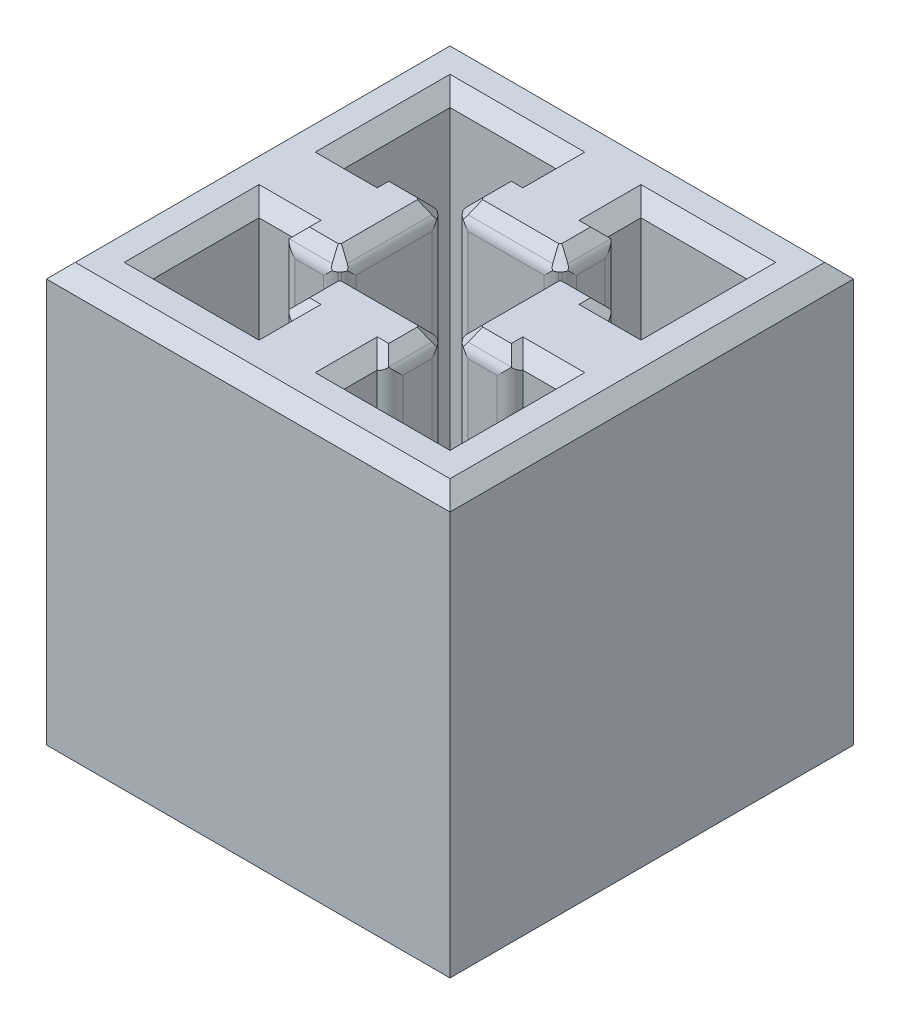
from build123d import *

# Parameters (mm, degrees)
SKETCH_2_W      = 28
SKETCH_2_H      = 28
SKETCH_2_W_2    = 20.6
SKETCH_2_H_2    = 20.6
EXTRUDE_2_DEPTH = 30
CHAMFER_1_SIZE  = 1
FILLET_3_R      = 1


with BuildPart() as part:
    # 草图2 → 凸台-拉伸2 (new body)
    # profile 1 of 5: a face of its own
    with BuildSketch(Plane(origin=(0, 0, 0), x_dir=(1, 0, 0), z_dir=(0, 1, 0))):
        Rectangle(SKETCH_2_W, SKETCH_2_H)
        Rectangle(SKETCH_2_W_2, SKETCH_2_H_2, mode=Mode.SUBTRACT)
    # profile 2 of 5: a face of its own
    with BuildSketch(Plane(origin=(0, 0, 0), x_dir=(1, 0, 0), z_dir=(0, 1, 0))):
        Polygon((-2.95, -8), (-2.95, -10.3), (2.95, -10.3), (2.95, -8), (3.75, -8), (3.75, -4.598528137), (3.051471863, -3.9), (-3.051471863, -3.9), (-3.75, -4.598528137), (-3.75, -8), align=None)
    # profile 3 of 5: a face of its own
    with BuildSketch(Plane(origin=(0, 0, 0), x_dir=(1, 0, 0), z_dir=(0, 1, 0))):
        Polygon((10.3, -2.95), (10.3, 2.95), (8, 2.95), (8, 3.75), (4.598528137, 3.75), (3.9, 3.051471863), (3.9, -3.051471863), (4.598528137, -3.75), (8, -3.75), (8, -2.95), align=None)
    # profile 4 of 5: a face of its own
    with BuildSketch(Plane(origin=(0, 0, 0), x_dir=(1, 0, 0), z_dir=(0, 1, 0))):
        Polygon((2.95, 10.3), (-2.95, 10.3), (-2.95, 8), (-3.75, 8), (-3.75, 4.598528137), (-3.051471863, 3.9), (3.051471863, 3.9), (3.75, 4.598528137), (3.75, 8), (2.95, 8), align=None)
    # profile 5 of 5: a face of its own
    with BuildSketch(Plane(origin=(0, 0, 0), x_dir=(1, 0, 0), z_dir=(0, 1, 0))):
        Polygon((-8, 2.95), (-10.3, 2.95), (-10.3, -2.95), (-8, -2.95), (-8, -3.75), (-4.598528137, -3.75), (-3.9, -3.051471863), (-3.9, 3.051471863), (-4.598528137, 3.75), (-8, 3.75), align=None)
    extrude(amount=EXTRUDE_2_DEPTH)

    # 倒角1
    chamfer_1_edges = [part.edges().sort_by_distance(p)[0] for p in [
        (6.299264069, 30, -3.75),
        (4.249264069, 30, -3.400735931),
        (3.9, 30, 0),
        (4.249264069, 30, 3.400735931),
        (-10.3, 30, -6.625),
        (6.299264069, 30, 3.75),
        (8, 30, 3.35),
        (9.15, 30, 2.95),
        (10.3, 30, 6.625),
        (6.625, 30, 10.3),
        (2.95, 30, 9.15),
        (3.35, 30, 8),
        (3.75, 30, 6.299264069),
        (3.400735931, 30, 4.249264069),
        (0, 30, 3.9),
        (-6.625, 30, -10.3),
        (-3.400735931, 30, 4.249264069),
        (-3.75, 30, 6.299264069),
        (-3.35, 30, 8),
        (-2.95, 30, 9.15),
        (-6.625, 30, 10.3),
        (-10.3, 30, 6.625),
        (-9.15, 30, 2.95),
        (-8, 30, 3.35),
        (-6.299264069, 30, 3.75),
        (-4.249264069, 30, 3.400735931),
        (-3.9, 30, 0),
        (-2.95, 30, -9.15),
        (-4.249264069, 30, -3.400735931),
        (-6.299264069, 30, -3.75),
        (-8, 30, -3.35),
        (-14, 30, 0),
        (0, 30, 14),
        (14, 30, 0),
        (0, 30, -14),
        (-3.35, 30, -8),
        (-3.75, 30, -6.299264069),
        (-3.400735931, 30, -4.249264069),
        (0, 30, -3.9),
        (3.400735931, 30, -4.249264069),
        (0, 0, -14),
        (14, 0, 0),
        (0, 0, 14),
        (-14, 0, 0),
        (-8, 0, -3.35),
        (-6.299264069, 0, -3.75),
        (-4.249264069, 0, -3.400735931),
        (-3.9, 0, 0),
        (-4.249264069, 0, 3.400735931),
        (-6.299264069, 0, 3.75),
        (-9.15, 30, -2.95),
        (3.75, 30, -6.299264069),
        (-8, 0, 3.35),
        (-9.15, 0, 2.95),
        (-10.3, 0, 6.625),
        (-6.625, 0, 10.3),
        (-2.95, 0, 9.15),
        (-3.35, 0, 8),
        (-3.75, 0, 6.299264069),
        (-3.400735931, 0, 4.249264069),
        (0, 0, 3.9),
        (3.400735931, 0, 4.249264069),
        (3.35, 30, -8),
        (3.75, 0, 6.299264069),
        (3.35, 0, 8),
        (2.95, 0, 9.15),
        (6.625, 0, 10.3),
        (10.3, 0, 6.625),
        (9.15, 0, 2.95),
        (8, 0, 3.35),
        (6.299264069, 0, 3.75),
        (4.249264069, 0, 3.400735931),
        (3.9, 0, 0),
        (2.95, 30, -9.15),
        (4.249264069, 0, -3.400735931),
        (6.299264069, 0, -3.75),
        (8, 0, -3.35),
        (9.15, 0, -2.95),
        (10.3, 0, -6.625),
        (6.625, 0, -10.3),
        (2.95, 0, -9.15),
        (3.35, 0, -8),
        (3.75, 0, -6.299264069),
        (3.400735931, 0, -4.249264069),
        (6.625, 30, -10.3),
        (0, 0, -3.9),
        (-3.400735931, 0, -4.249264069),
        (-3.75, 0, -6.299264069),
        (-3.35, 0, -8),
        (-2.95, 0, -9.15),
        (-6.625, 0, -10.3),
        (-10.3, 0, -6.625),
        (10.3, 30, -6.625),
        (-9.15, 0, -2.95),
        (9.15, 30, -2.95),
        (8, 30, -3.35),
    ]]
    chamfer(chamfer_1_edges, length=CHAMFER_1_SIZE)

    # 圆角3
    # the kernel refuses this fillet: 1 mm, written as the material it takes off along each edge
    with BuildSketch(Plane(origin=(3.75, 1, 9.035533906), x_dir=(-0.7071067811865477, -0.7071067811865474, 0), z_dir=(0, 0, -1)), Plane(origin=(9.035533906, 1, -3.75), x_dir=(0, -0.7071067811865477, 0.7071067811865474), z_dir=(-1, 0, 0)), Plane(origin=(3.562994231, 1, 3.75), x_dir=(0, -0.7071067811865475, -0.7071067811865477), z_dir=(1, 0, 0)), Plane(origin=(-3.75, 1, 3.562994231), x_dir=(0.7071067811865472, -0.7071067811865478, 0), z_dir=(0, 0, 1)), Plane(origin=(3.75, 1, -3.562994231), x_dir=(-0.7071067811865477, -0.7071067811865475, 0), z_dir=(0, 0, -1)), Plane(origin=(-3.75, 1, -9.035533906), x_dir=(0.7071067811865472, -0.7071067811865478, 0), z_dir=(0, 0, 1)), Plane(origin=(-3.562994231, 1, -3.75), x_dir=(0, -0.7071067811865475, 0.7071067811865477), z_dir=(-1, 0, 0)), Plane(origin=(-9.035533906, 1, 3.75), x_dir=(0, -0.7071067811865475, -0.7071067811865477), z_dir=(1, 0, 0))) as fillet_3_piece_1:
        with BuildLine():
            CenterArc((FILLET_3_R * 0.414213562373, FILLET_3_R), FILLET_3_R, 225, 45)
            Line((-FILLET_3_R * 0.292893218813, FILLET_3_R * 0.292893218813), (-FILLET_3_R * 0.307035354437, FILLET_3_R * 0.27875108319))
            Line((-FILLET_3_R * 0.307035354437, FILLET_3_R * 0.27875108319), (-FILLET_3_R * 0.00828427124746, -FILLET_3_R * 0.02))
            Line((-FILLET_3_R * 0.00828427124746, -FILLET_3_R * 0.02), (FILLET_3_R * 0.414213562373, -FILLET_3_R * 0.02))
            Line((FILLET_3_R * 0.414213562373, -FILLET_3_R * 0.02), (FILLET_3_R * 0.414213562373, 0))
        make_face()
    extrude(amount=5.472539674, mode=Mode.SUBTRACT)
    with BuildSketch(Plane(origin=(3.75, -1.449489743, 8), x_dir=(0, 0, -1), z_dir=(0, 1, 0)), Plane(origin=(-8, -1.449489743, 3.75), x_dir=(1, 0, 0), z_dir=(0, 1, 0))) as fillet_3_piece_2:
        with BuildLine():
            CenterArc((0.979795897, 1), FILLET_3_R, 191.536959033, 78.463040967)
            Line((0, 0.8), (-0.019595918, 0.796))
            ThreePointArc((-0.019595918, 0.796), (-0.02, 0.4), (-0.02, 0))
            Line((-0.02, 0), (0, -0.02))
            Line((0, -0.02), (0.979795897, -0.02))
            Line((0.979795897, -0.02), (0.979795897, 0))
        make_face()
    extrude(amount=32.898979486, mode=Mode.SUBTRACT)
    with BuildSketch(Plane(origin=(3.75, 29, 9.035533906), x_dir=(-0.7071067811865487, 0.7071067811865465, 0), z_dir=(0, 0, -1)), Plane(origin=(9.035533906, 29, -3.75), x_dir=(0, 0.7071067811865476, 0.7071067811865476), z_dir=(-1, 0, 0)), Plane(origin=(3.562994231, 29, 3.75), x_dir=(0, 0.707106781186547, -0.707106781186548), z_dir=(1, 0, 0)), Plane(origin=(-3.75, 29, 3.562994231), x_dir=(0.7071067811865459, 0.7071067811865491, 0), z_dir=(0, 0, 1)), Plane(origin=(3.75, 29, -3.562994231), x_dir=(-0.707106781186548, 0.707106781186547, 0), z_dir=(0, 0, -1)), Plane(origin=(-3.75, 29, -9.035533906), x_dir=(0.7071067811865465, 0.7071067811865487, 0), z_dir=(0, 0, 1)), Plane(origin=(-3.562994231, 29, -3.75), x_dir=(0, 0.707106781186547, 0.707106781186548), z_dir=(-1, 0, 0)), Plane(origin=(-9.035533906, 29, 3.75), x_dir=(0, 0.707106781186547, -0.707106781186548), z_dir=(1, 0, 0))) as fillet_3_piece_3:
        with BuildLine():
            CenterArc((FILLET_3_R * 0.414213562373, -FILLET_3_R), FILLET_3_R, 90, 45)
            Line((-FILLET_3_R * 0.292893218813, -FILLET_3_R * 0.292893218813), (-FILLET_3_R * 0.307035354437, -FILLET_3_R * 0.27875108319))
            Line((-FILLET_3_R * 0.307035354437, -FILLET_3_R * 0.27875108319), (-FILLET_3_R * 0.00828427124746, FILLET_3_R * 0.02))
            Line((-FILLET_3_R * 0.00828427124746, FILLET_3_R * 0.02), (FILLET_3_R * 0.414213562373, FILLET_3_R * 0.02))
            Line((FILLET_3_R * 0.414213562373, FILLET_3_R * 0.02), (FILLET_3_R * 0.414213562373, 0))
        make_face()
    extrude(amount=5.472539674, mode=Mode.SUBTRACT)
    with BuildSketch(Plane(origin=(3.75, -0.035533906, 4.598528137), x_dir=(-0.7071067811865872, 0, -0.7071067811865078), z_dir=(0, 1, 0)), Plane(origin=(3.051471863, -0.035533906, 3.9), x_dir=(-1, 0, 0), z_dir=(0, 1, 0)), Plane(origin=(-3.051471863, -0.035533906, 3.9), x_dir=(-0.7071067811865154, 0, 0.7071067811865797), z_dir=(0, 1, 0)), Plane(origin=(-3.75, -0.035533906, 4.598528137), x_dir=(0, 0, 1), z_dir=(0, 1, 0)), Plane(origin=(-4.598528137, -0.035533906, -3.75), x_dir=(-1, 0, 0), z_dir=(0, 1, 0)), Plane(origin=(-3.9, -0.035533906, 3.051471863), x_dir=(0, 0, -1), z_dir=(0, 1, 0)), Plane(origin=(-3.9, -0.035533906, -3.051471863), x_dir=(-0.7071067811865459, 0, -0.7071067811865491), z_dir=(0, 1, 0)), Plane(origin=(-4.598528137, -0.035533906, 3.75), x_dir=(0.707106781186547, 0, -0.707106781186548), z_dir=(0, 1, 0))) as fillet_3_piece_4:
        with BuildLine():
            CenterArc((FILLET_3_R * 0.414213562373, FILLET_3_R), FILLET_3_R, 225, 45)
            Line((-FILLET_3_R * 0.292893218813, FILLET_3_R * 0.292893218813), (-FILLET_3_R * 0.307035354437, FILLET_3_R * 0.27875108319))
            Line((-FILLET_3_R * 0.307035354437, FILLET_3_R * 0.27875108319), (-FILLET_3_R * 0.00828427124746, -FILLET_3_R * 0.02))
            Line((-FILLET_3_R * 0.00828427124746, -FILLET_3_R * 0.02), (FILLET_3_R * 0.414213562373, -FILLET_3_R * 0.02))
            Line((FILLET_3_R * 0.414213562373, -FILLET_3_R * 0.02), (FILLET_3_R * 0.414213562373, 0))
        make_face()
    extrude(amount=30.071067812, mode=Mode.SUBTRACT)
    with BuildSketch(Plane(origin=(8, -1.449489743, -3.75), x_dir=(-1.5698553568194776e-12, 0, 1.0), z_dir=(0, 1, 0)), Plane(origin=(-3.75, -1.449489743, -8), x_dir=(1.0, 0, 1.5754064719426007e-12), z_dir=(0, 1, 0))) as fillet_3_piece_5:
        with BuildLine():
            CenterArc((1, -0.979795897), FILLET_3_R, 101.536959033, 78.463040967)
            Line((0, -0.979795897), (-0.02, -0.979795897))
            Line((-0.02, -0.979795897), (-0.02, 0))
            Line((-0.02, 0), (0, 0.02))
            ThreePointArc((0, 0.02), (0.4, 0.02), (0.796, 0.019595918))
            Line((0.796, 0.019595918), (0.8, 0))
        make_face()
    extrude(amount=32.898979486, mode=Mode.SUBTRACT)
    with BuildSketch(Plane(origin=(4.598528137, -0.035533906, -3.75), x_dir=(1, 0, 0), z_dir=(0, 1, 0)), Plane(origin=(4.598528137, -0.035533906, 3.75), x_dir=(-0.707106781186569, 0, -0.7071067811865261), z_dir=(0, 1, 0)), Plane(origin=(3.9, -0.035533906, -3.051471863), x_dir=(0.7071067811865169, 0, -0.7071067811865781), z_dir=(0, 1, 0)), Plane(origin=(3.9, -0.035533906, 3.051471863), x_dir=(0, 0, -1), z_dir=(0, 1, 0)), Plane(origin=(3.75, -0.035533906, -4.598528137), x_dir=(-0.7071067811865364, 0, 0.7071067811865588), z_dir=(0, 1, 0)), Plane(origin=(-3.75, -0.035533906, -4.598528137), x_dir=(0, 0, -1), z_dir=(0, 1, 0)), Plane(origin=(-3.051471863, -0.035533906, -3.9), x_dir=(-0.7071067811865637, 0, -0.7071067811865315), z_dir=(0, 1, 0)), Plane(origin=(3.051471863, -0.035533906, -3.9), x_dir=(-1, 0, 0), z_dir=(0, 1, 0))) as fillet_3_piece_6:
        with BuildLine():
            CenterArc((FILLET_3_R * 0.414213562373, -FILLET_3_R), FILLET_3_R, 90, 45)
            Line((-FILLET_3_R * 0.292893218813, -FILLET_3_R * 0.292893218813), (-FILLET_3_R * 0.307035354437, -FILLET_3_R * 0.27875108319))
            Line((-FILLET_3_R * 0.307035354437, -FILLET_3_R * 0.27875108319), (-FILLET_3_R * 0.00828427124746, FILLET_3_R * 0.02))
            Line((-FILLET_3_R * 0.00828427124746, FILLET_3_R * 0.02), (FILLET_3_R * 0.414213562373, FILLET_3_R * 0.02))
            Line((FILLET_3_R * 0.414213562373, FILLET_3_R * 0.02), (FILLET_3_R * 0.414213562373, 0))
        make_face()
    extrude(amount=30.071067812, mode=Mode.SUBTRACT)
    with BuildSketch(Plane(origin=(8, -1.449489743, 3.75), x_dir=(-1, 0, 0), z_dir=(0, 1, 0)), Plane(origin=(3.75, -1.449489743, -8), x_dir=(0, 0, 1), z_dir=(0, 1, 0))) as fillet_3_piece_7:
        with BuildLine():
            CenterArc((0.979795897, -1), FILLET_3_R, 90, 78.463040967)
            Line((0, -0.8), (-0.019595918, -0.796))
            ThreePointArc((-0.019595918, -0.796), (-0.02, -0.4), (-0.02, 0))
            Line((-0.02, 0), (0, 0.02))
            Line((0, 0.02), (0.979795897, 0.02))
            Line((0.979795897, 0.02), (0.979795897, 0))
        make_face()
    extrude(amount=32.898979486, mode=Mode.SUBTRACT)
    with BuildSketch(Plane(origin=(3.9, 1, -4.087005769), x_dir=(0.707106781186547, -0.7071067811865481, 4.939546645742046e-15), z_dir=(0, 0, 1)), Plane(origin=(4.087005769, 1, 3.9), x_dir=(-7.46077357950622e-15, -0.7071067811865477, 0.7071067811865475), z_dir=(-1, 0, 0)), Plane(origin=(-4.087005769, 1, -3.9), x_dir=(2.521226933764171e-15, -0.7071067811865477, -0.7071067811865474), z_dir=(1, 0, 0)), Plane(origin=(-3.9, 1, 4.087005769), x_dir=(-0.7071067811865475, -0.7071067811865475, 0), z_dir=(0, 0, -1))) as fillet_3_piece_8:
        with BuildLine():
            CenterArc((FILLET_3_R * 0.414213562373, FILLET_3_R), FILLET_3_R, 225, 45)
            Line((-FILLET_3_R * 0.292893218813, FILLET_3_R * 0.292893218813), (-FILLET_3_R * 0.307035354437, FILLET_3_R * 0.27875108319))
            Line((-FILLET_3_R * 0.307035354437, FILLET_3_R * 0.27875108319), (-FILLET_3_R * 0.00828427124746, -FILLET_3_R * 0.02))
            Line((-FILLET_3_R * 0.00828427124746, -FILLET_3_R * 0.02), (FILLET_3_R * 0.414213562373, -FILLET_3_R * 0.02))
            Line((FILLET_3_R * 0.414213562373, -FILLET_3_R * 0.02), (FILLET_3_R * 0.414213562373, 0))
        make_face()
    extrude(amount=8.174011537, mode=Mode.SUBTRACT)
    with BuildSketch(Plane(origin=(3.9, 29, -4.087005769), x_dir=(0.7071067811865455, 0.7071067811865497, 4.939546645742035e-15), z_dir=(0, 0, 1)), Plane(origin=(4.087005769, 29, 3.9), x_dir=(-7.460773579506227e-15, 0.707106781186547, 0.707106781186548), z_dir=(-1, 0, 0)), Plane(origin=(-4.087005769, 29, -3.9), x_dir=(2.5212269337641712e-15, 0.7071067811865476, -0.7071067811865476), z_dir=(1, 0, 0)), Plane(origin=(-3.9, 29, 4.087005769), x_dir=(-0.7071067811865476, 0.7071067811865476, 0), z_dir=(0, 0, -1))) as fillet_3_piece_9:
        with BuildLine():
            CenterArc((FILLET_3_R * 0.414213562373, -FILLET_3_R), FILLET_3_R, 90, 45)
            Line((-FILLET_3_R * 0.292893218813, -FILLET_3_R * 0.292893218813), (-FILLET_3_R * 0.307035354437, -FILLET_3_R * 0.27875108319))
            Line((-FILLET_3_R * 0.307035354437, -FILLET_3_R * 0.27875108319), (-FILLET_3_R * 0.00828427124746, FILLET_3_R * 0.02))
            Line((-FILLET_3_R * 0.00828427124746, FILLET_3_R * 0.02), (FILLET_3_R * 0.414213562373, FILLET_3_R * 0.02))
            Line((FILLET_3_R * 0.414213562373, FILLET_3_R * 0.02), (FILLET_3_R * 0.414213562373, 0))
        make_face()
    extrude(amount=8.174011537, mode=Mode.SUBTRACT)
    with BuildSketch(Plane(origin=(-3.75, -1.449489743, 8), x_dir=(1.0, 0, -1.566524687746745e-12), z_dir=(0, 1, 0)), Plane(origin=(-8, -1.449489743, -3.75), x_dir=(1.5765166949683711e-12, 0, 1.0), z_dir=(0, 1, 0))) as fillet_3_piece_10:
        with BuildLine():
            CenterArc((1, 0.979795897), FILLET_3_R, 180, 78.463040967)
            Line((0, 0.979795897), (-0.02, 0.979795897))
            Line((-0.02, 0.979795897), (-0.02, 0))
            Line((-0.02, 0), (0, -0.02))
            ThreePointArc((0, -0.02), (0.4, -0.02), (0.796, -0.019595918))
            Line((0.796, -0.019595918), (0.8, 0))
        make_face()
    extrude(amount=32.898979486, mode=Mode.SUBTRACT)


solid = part.part
